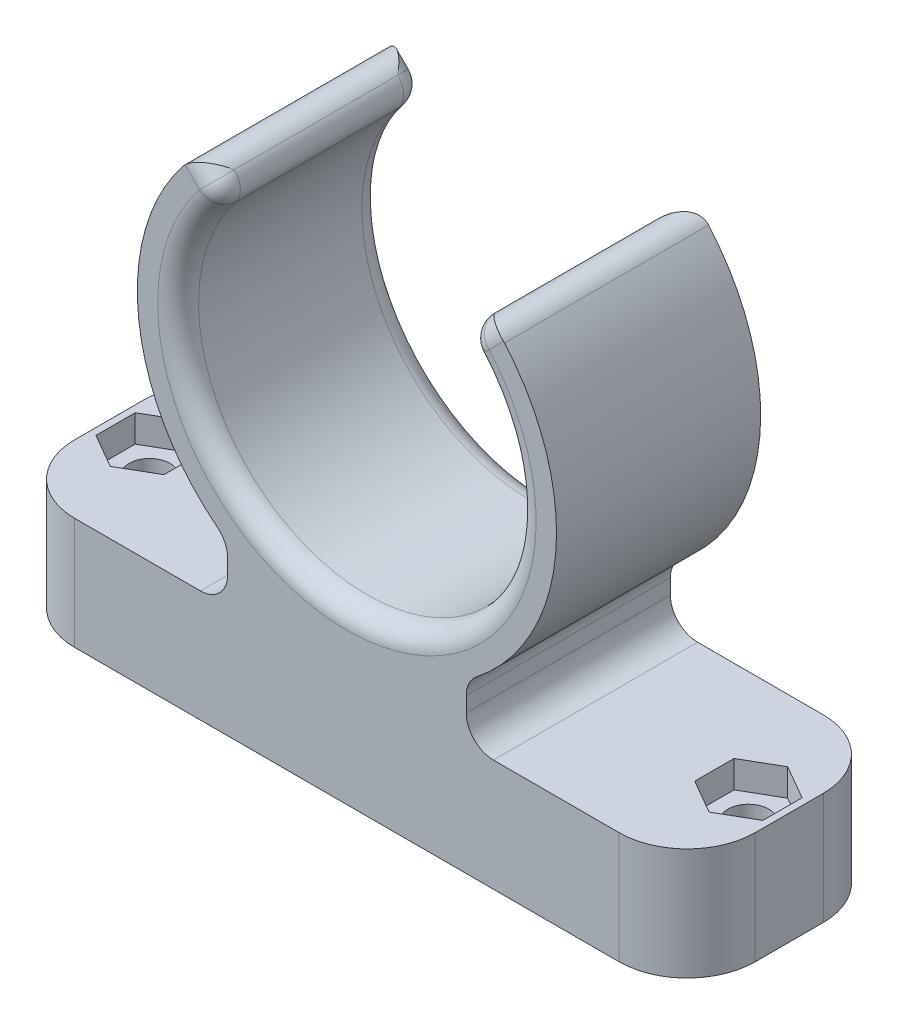
from build123d import *

# Parameters (mm, degrees)
RESSALTO_EXTRUS_O1_DEPTH = 15
ESBO_O3_R                = 1.5
CORTE_EXTRUS_O1_DEPTH    = 8.219669914
CORTE_EXTRUS_O2_DEPTH    = 2
FILETE1_R                = 1.5
FILETE2_R                = 2
FILETE3_R                = 5


with BuildPart() as part:
    # Esboço2 → Ressalto-extrusão1 (new body)
    with BuildSketch(Plane.XY):
        with BuildLine():
            Line((-25, -4.380330086), (-25, -12.6))
            Line((-25, -12.6), (25, -12.6))
            Line((25, -12.6), (25, -4.380330086))
            Line((25, -4.380330086), (8.768124087, -4.380330086))
            Line((8.768124087, -4.380330086), (8.768124087, -0.260173774))
            ThreePointArc((8.768124087, -0.260173774), (15.361943152, 11.318009898), (10.456147688, 23.706147688))
            Line((10.456147688, 23.706147688), (8.332817936, 21.582817936))
            ThreePointArc((8.332817936, 21.582817936), (0.30060873, 0.00364431), (-8.768124087, 21.168124087))
            Line((-8.768124087, 21.168124087), (-10.88944443, 23.28944443))
            ThreePointArc((-10.88944443, 23.28944443), (-15.337898467, 11.018381166), (-8.768124087, -0.260173774))
            Line((-8.768124087, -0.260173774), (-8.768124087, -4.380330086))
            Line((-8.768124087, -4.380330086), (-25, -4.380330086))
        make_face()
    extrude(amount=RESSALTO_EXTRUS_O1_DEPTH)

    # Esboço3 → Corte-extrusão1 (cut)
    with BuildSketch(Plane(origin=(0, -4.380330086, 0), x_dir=(1, 0, 0), z_dir=(0, 1, 0))):
        with Locations(Location((22, -7.5, 0), (0, 0, 270))):
            Circle(ESBO_O3_R)
        with Locations(Location((-22, -7.5, 0), (0, 0, 180))):
            Circle(ESBO_O3_R)
    extrude(amount=-CORTE_EXTRUS_O1_DEPTH, mode=Mode.SUBTRACT)

    # Esboço5 → Corte-extrusão2 (cut)
    with BuildSketch(Plane(origin=(0, -4.380330086, 0), x_dir=(1, 0, 0), z_dir=(0, 1, 0))):
        Polygon((22, -4.613248654), (19.5, -6.056624327), (19.5, -8.943375673), (22, -10.386751346), (24.5, -8.943375673), (24.5, -6.056624327), align=None)
        Polygon((-24.5, -6.056624327), (-22, -4.613248654), (-19.5, -6.056624327), (-19.5, -8.943375673), (-22, -10.386751346), (-24.5, -8.943375673), align=None)
    extrude(amount=-CORTE_EXTRUS_O2_DEPTH, mode=Mode.SUBTRACT)

    # Filete1
    filete1_edges = [part.edges().sort_by_distance(p)[0] for p in [
        (9.394482812, 22.644482812, 15),
        (-9.828784258, 22.228784258, 0),
        (0.30060873, 0.00364431, 0),
        (9.394482812, 22.644482812, 0),
        (0.30060873, 0.00364431, 15),
        (-10.88944443, 23.28944443, 7.5),
        (-8.768124087, 21.168124087, 7.5),
        (8.332817936, 21.582817936, 7.5),
        (10.456147688, 23.706147688, 7.5),
        (-9.828784258, 22.228784258, 15),
    ]]
    fillet(filete1_edges, radius=FILETE1_R - 0.0001)  # a hair under: the kernel refuses the full size

    # Filete2
    filete2_edges = [part.edges().sort_by_distance(p)[0] for p in [
        (8.768124087, -4.380330086, 7.5),
        (-8.768124087, -4.380330086, 7.5),
        (-8.768124087, -0.260173774, 7.5),
        (8.768124087, -0.260173774, 7.5),
    ]]
    fillet(filete2_edges, radius=FILETE2_R)

    # Filete3
    filete3_edges = [part.edges().sort_by_distance(p)[0] for p in [
        (25, -8.490165043, 0),
        (-25, -8.490165043, 0),
        (-25, -8.490165043, 15),
        (25, -8.490165043, 15),
    ]]
    fillet(filete3_edges, radius=FILETE3_R)


solid = part.part
